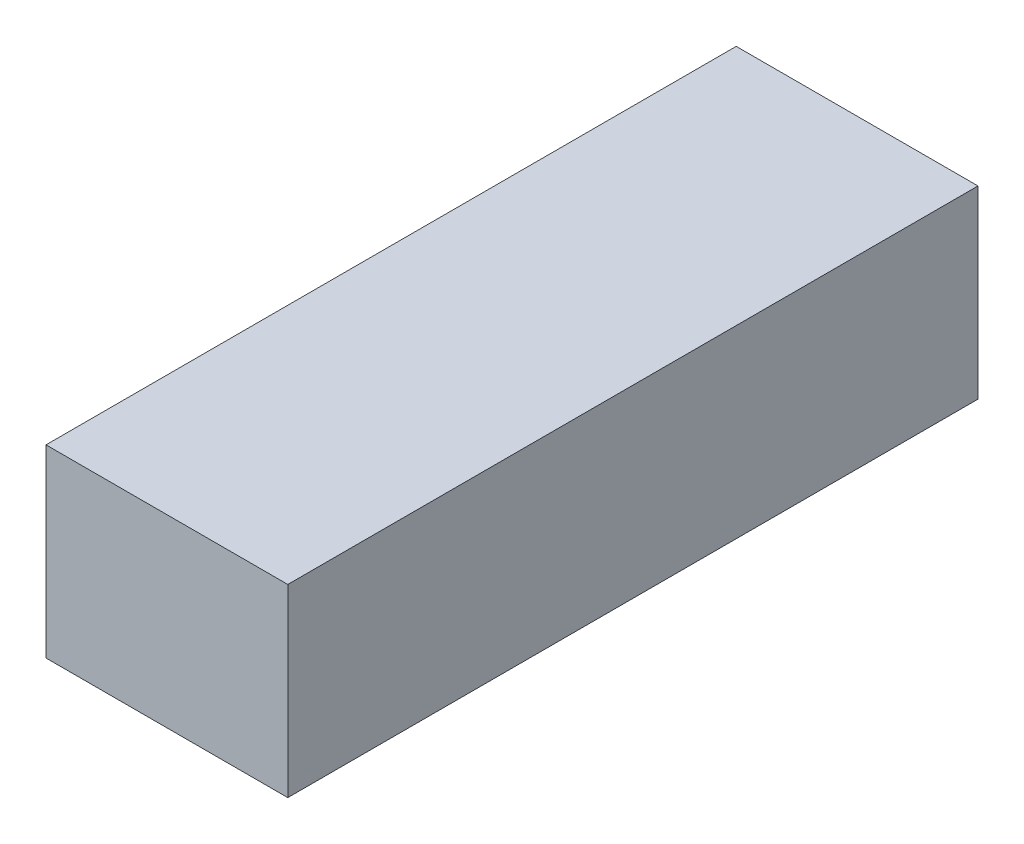
from build123d import *

# Parameters (mm, degrees)
SZKIC1_W                    = 55
SZKIC1_H                    = 157
DODANIE_WYCI_GNI_CIE1_DEPTH = 42


with BuildPart() as part:
    # Szkic1 → Dodanie-wyciągnięcie1 (new body)
    with BuildSketch(Plane(origin=(0, 0, 0), x_dir=(1, 0, 0), z_dir=(0, 1, 0))):
        with Locations((27.5, 78.5)):
            Rectangle(SZKIC1_W, SZKIC1_H)
    extrude(amount=DODANIE_WYCI_GNI_CIE1_DEPTH)


solid = part.part
